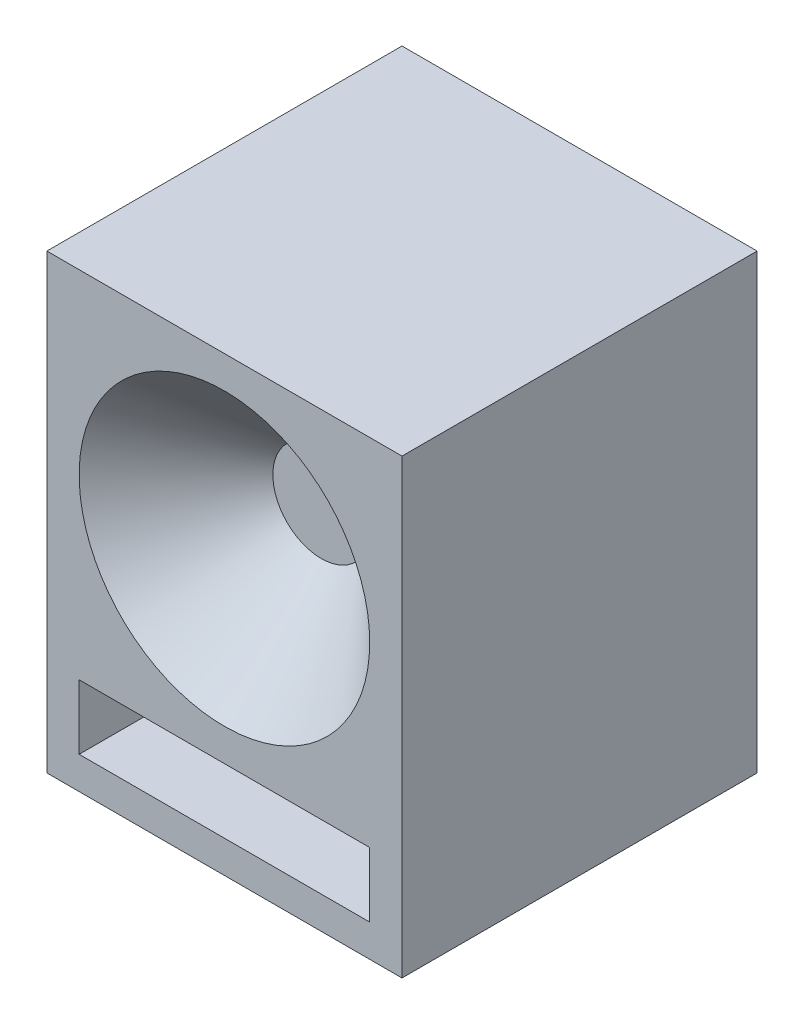
from build123d import *

# Parameters (mm, degrees)
SKETCH1_W           = 558.8
SKETCH1_H           = 711.2
BOSS_EXTRUDE1_DEPTH = 558.8
SKETCH2_R           = 228.6
SKETCH2_W           = 457.2
SKETCH2_H           = 101.6
CUT_EXTRUDE1_DEPTH  = 152.4
CHAMFER1_SIZE       = 152.4


with BuildPart() as part:
    # Sketch1 → Boss-Extrude1 (new body)
    with BuildSketch(Plane.XY):
        with Locations((0, -76.2)):
            Rectangle(SKETCH1_W, SKETCH1_H)
    extrude(amount=BOSS_EXTRUDE1_DEPTH)

    # Sketch2 → Cut-Extrude1 (cut)
    with BuildSketch(Plane.XY.offset(558.8)):
        Circle(SKETCH2_R)
        with Locations((0, -330.2)):
            Rectangle(SKETCH2_W, SKETCH2_H)
    extrude(amount=-CUT_EXTRUDE1_DEPTH, mode=Mode.SUBTRACT)

    # Chamfer1
    chamfer1_edges = [part.edges().sort_by_distance(p)[0] for p in [
        (-228.6, 0, 406.4),
    ]]
    chamfer(chamfer1_edges, length=CHAMFER1_SIZE - 0.0001)  # a hair under: the kernel refuses the full size


solid = part.part
